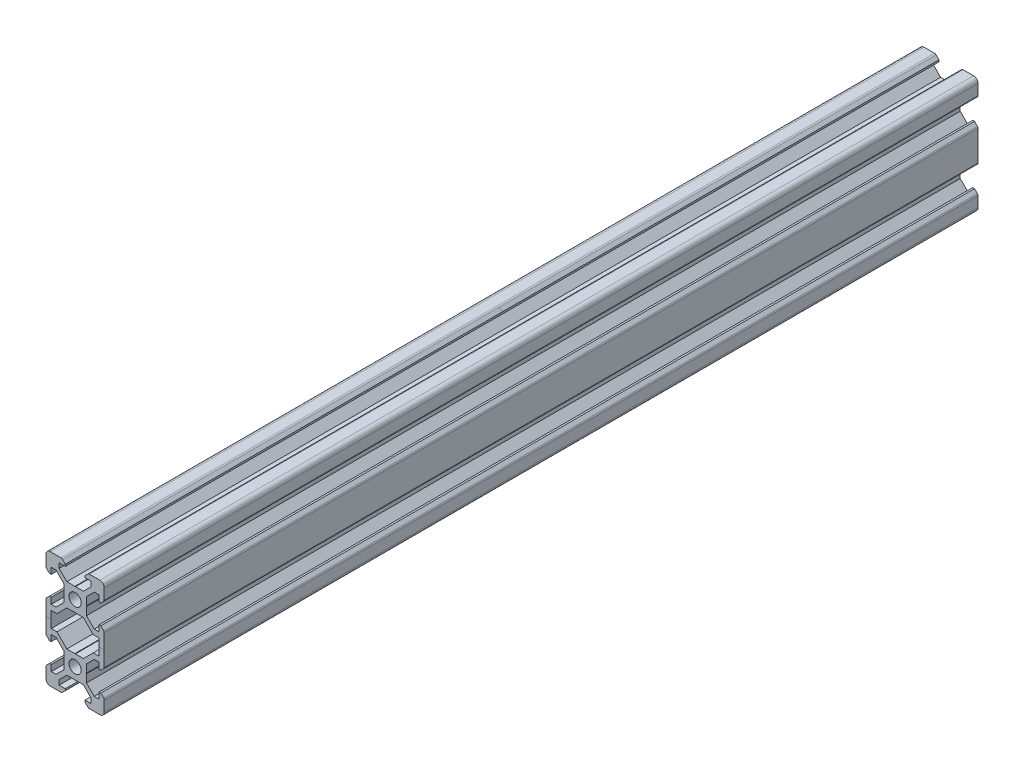
from build123d import *

# Parameters (mm, degrees)
SKETCH1_R           = 2.1
BOSS_EXTRUDE2_DEPTH = 300


with BuildPart() as part:
    # Sketch1 → Boss-Extrude2 (new body)
    with BuildSketch(Plane.XY):
        with BuildLine():
            Line((-8.5, 10), (-4.862792737, 10))
            ThreePointArc((-4.862792737, 10), (-4.598292737, 9.947387679), (-4.374060464, 9.797560464))
            Line((-4.374060464, 9.797560464), (-3.3865, 8.81))
            Line((-3.3865, 8.81), (-3.3865, 8.2))
            Line((-3.3865, 8.2), (-5.5, 8.2))
            Line((-5.5, 8.2), (-5.5, 6.561))
            Line((-5.5, 6.561), (-2.8395, 3.9005))
            Line((-2.8395, 3.9005), (-0.1, 3.9005))
            Line((-0.1, 3.9005), (0, 3.8005))
            Line((0, 3.8005), (0.1, 3.9005))
            Line((0.1, 3.9005), (2.8395, 3.9005))
            Line((2.8395, 3.9005), (5.5, 6.561))
            Line((5.5, 6.561), (5.5, 8.2))
            Line((5.5, 8.2), (3.3865, 8.2))
            Line((3.3865, 8.2), (3.3865, 8.81))
            Line((3.3865, 8.81), (4.374060464, 9.797560464))
            ThreePointArc((4.374060464, 9.797560464), (4.598292737, 9.947387679), (4.862792737, 10))
            Line((4.862792737, 10), (8.5, 10))
            ThreePointArc((8.5, 10), (9.560660172, 9.560660172), (10, 8.5))
            Line((10, 8.5), (10, 4.862792737))
            ThreePointArc((10, 4.862792737), (9.947387679, 4.598292737), (9.797560464, 4.374060464))
            Line((9.797560464, 4.374060464), (8.81, 3.3865))
            Line((8.81, 3.3865), (8.2, 3.3865))
            Line((8.2, 3.3865), (8.2, 5.5))
            Line((8.2, 5.5), (6.561, 5.5))
            Line((6.561, 5.5), (3.9005, 2.8395))
            Line((3.9005, 2.8395), (3.9005, 0.1))
            Line((3.9005, 0.1), (3.8005, 0))
            Line((3.8005, 0), (3.9005, -0.1))
            Line((3.9005, -0.1), (3.9005, -2.8395))
            Line((3.9005, -2.8395), (6.561, -5.5))
            Line((6.561, -5.5), (8.2, -5.5))
            Line((8.2, -5.5), (8.2, -3.3865))
            Line((8.2, -3.3865), (8.81, -3.3865))
            Line((8.81, -3.3865), (9.797560464, -4.374060464))
            ThreePointArc((9.797560464, -4.374060464), (9.947387679, -4.598292737), (10, -4.862792737))
            Line((10, -4.862792737), (10, -15.137207263))
            ThreePointArc((10, -15.137207263), (9.947387679, -15.401707263), (9.797560464, -15.625939536))
            Line((9.797560464, -15.625939536), (8.81, -16.6135))
            Line((8.81, -16.6135), (8.2, -16.6135))
            Line((8.2, -16.6135), (8.2, -14.5))
            Line((8.2, -14.5), (6.561, -14.5))
            Line((6.561, -14.5), (3.9005, -17.1605))
            Line((3.9005, -17.1605), (3.9005, -19.9))
            Line((3.9005, -19.9), (3.8005, -20))
            Line((3.8005, -20), (3.9005, -20.1))
            Line((3.9005, -20.1), (3.9005, -22.8395))
            Line((3.9005, -22.8395), (6.561, -25.5))
            Line((6.561, -25.5), (8.2, -25.5))
            Line((8.2, -25.5), (8.2, -23.3865))
            Line((8.2, -23.3865), (8.81, -23.3865))
            Line((8.81, -23.3865), (9.797560464, -24.374060464))
            ThreePointArc((9.797560464, -24.374060464), (9.947387679, -24.598292737), (10, -24.862792737))
            Line((10, -24.862792737), (10, -28.5))
            ThreePointArc((10, -28.5), (9.560660172, -29.560660172), (8.5, -30))
            Line((8.5, -30), (4.862792737, -30))
            ThreePointArc((4.862792737, -30), (4.598292737, -29.947387679), (4.374060464, -29.797560464))
            Line((4.374060464, -29.797560464), (3.3865, -28.81))
            Line((3.3865, -28.81), (3.3865, -28.2))
            Line((3.3865, -28.2), (5.5, -28.2))
            Line((5.5, -28.2), (5.5, -26.561))
            Line((5.5, -26.561), (2.8395, -23.9005))
            Line((2.8395, -23.9005), (0.1, -23.9005))
            Line((0.1, -23.9005), (0, -23.8005))
            Line((0, -23.8005), (-0.1, -23.9005))
            Line((-0.1, -23.9005), (-2.8395, -23.9005))
            Line((-2.8395, -23.9005), (-5.5, -26.561))
            Line((-5.5, -26.561), (-5.5, -28.2))
            Line((-5.5, -28.2), (-3.3865, -28.2))
            Line((-3.3865, -28.2), (-3.3865, -28.81))
            Line((-3.3865, -28.81), (-4.374060464, -29.797560464))
            ThreePointArc((-4.374060464, -29.797560464), (-4.598292737, -29.947387679), (-4.862792737, -30))
            Line((-4.862792737, -30), (-8.5, -30))
            ThreePointArc((-8.5, -30), (-9.560660172, -29.560660172), (-10, -28.5))
            Line((-10, -28.5), (-10, -24.862792737))
            ThreePointArc((-10, -24.862792737), (-9.947387679, -24.598292737), (-9.797560464, -24.374060464))
            Line((-9.797560464, -24.374060464), (-8.81, -23.3865))
            Line((-8.81, -23.3865), (-8.2, -23.3865))
            Line((-8.2, -23.3865), (-8.2, -25.5))
            Line((-8.2, -25.5), (-6.561, -25.5))
            Line((-6.561, -25.5), (-3.9005, -22.8395))
            Line((-3.9005, -22.8395), (-3.9005, -20.1))
            Line((-3.9005, -20.1), (-3.8005, -20))
            Line((-3.8005, -20), (-3.9005, -19.9))
            Line((-3.9005, -19.9), (-3.9005, -17.1605))
            Line((-3.9005, -17.1605), (-6.561, -14.5))
            Line((-6.561, -14.5), (-8.2, -14.5))
            Line((-8.2, -14.5), (-8.2, -16.6135))
            Line((-8.2, -16.6135), (-8.81, -16.6135))
            Line((-8.81, -16.6135), (-9.797560464, -15.625939536))
            ThreePointArc((-9.797560464, -15.625939536), (-9.947387679, -15.401707263), (-10, -15.137207263))
            Line((-10, -15.137207263), (-10, -4.862792737))
            ThreePointArc((-10, -4.862792737), (-9.947387679, -4.598292737), (-9.797560464, -4.374060464))
            Line((-9.797560464, -4.374060464), (-8.81, -3.3865))
            Line((-8.81, -3.3865), (-8.2, -3.3865))
            Line((-8.2, -3.3865), (-8.2, -5.5))
            Line((-8.2, -5.5), (-6.561, -5.5))
            Line((-6.561, -5.5), (-3.9005, -2.8395))
            Line((-3.9005, -2.8395), (-3.9005, -0.1))
            Line((-3.9005, -0.1), (-3.8005, 0))
            Line((-3.8005, 0), (-3.9005, 0.1))
            Line((-3.9005, 0.1), (-3.9005, 2.8395))
            Line((-3.9005, 2.8395), (-6.561, 5.5))
            Line((-6.561, 5.5), (-8.2, 5.5))
            Line((-8.2, 5.5), (-8.2, 3.3865))
            Line((-8.2, 3.3865), (-8.81, 3.3865))
            Line((-8.81, 3.3865), (-9.797560464, 4.374060464))
            ThreePointArc((-9.797560464, 4.374060464), (-9.947387679, 4.598292737), (-10, 4.862792737))
            Line((-10, 4.862792737), (-10, 8.5))
            ThreePointArc((-10, 8.5), (-9.560660172, 9.560660172), (-8.5, 10))
        make_face()
        Circle(SKETCH1_R, mode=Mode.SUBTRACT)
        with Locations((0, -20)):
            Circle(SKETCH1_R, mode=Mode.SUBTRACT)
        Polygon((-8.2, -12.7), (-8.2, -7.3), (-6.239, -7.3), (-5.5, -6.561), (-2.8395, -3.9005), (-0.1, -3.9005), (0, -3.8005), (0.1, -3.9005), (2.8395, -3.9005), (5.5, -6.561), (6.239, -7.3), (8.2, -7.3), (8.2, -12.7), (6.239, -12.7), (5.5, -13.439), (2.8395, -16.0995), (0.1, -16.0995), (0, -16.1995), (-0.1, -16.0995), (-2.8395, -16.0995), (-5.5, -13.439), (-6.239, -12.7), align=None, mode=Mode.SUBTRACT)
    extrude(amount=BOSS_EXTRUDE2_DEPTH)


solid = part.part
